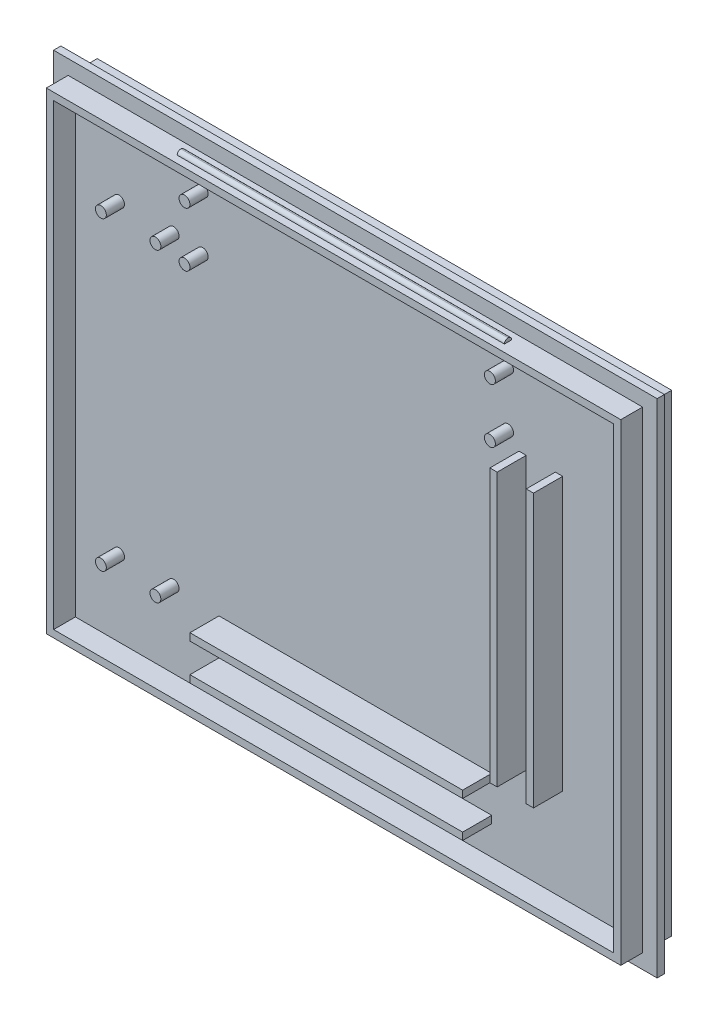
from build123d import *

# Parameters (mm, degrees)
SKETCH_1_W           = 166
SKETCH_1_H           = 138
EXTRUDE_1_DEPTH      = 2
EXTRUDE_2_DEPTH      = 6
EXTRUDE_2_DEPTH_BACK = 8
SKETCH_2_W           = 158
SKETCH_2_H           = 130
SKETCH_2_W_2         = 154
SKETCH_2_H_2         = 126
SKETCH_3_R           = 1.5
EXTRUDE_2_2_DEPTH    = 5
SKETCH_5_R           = 1.5
EXTRUDE_3_DEPTH      = 5
SKETCH_4_R           = 1.5
EXTRUDE_4_DEPTH      = 5
SKETCH_6_W           = 75
SKETCH_6_H           = 2
SKETCH_6_W_2         = 2
SKETCH_6_H_2         = 75
EXTRUDE_5_DEPTH      = 8
SKETCH_9_W           = 90
SKETCH_9_H           = 2
EXTRUDE_6_DEPTH      = 1
FILLET_1_R           = 1
SKETCH_11_W          = 90
SKETCH_11_H          = 2
EXTRUDE_7_DEPTH      = 1
FILLET_2_R           = 1


with BuildPart() as part:
    # 스케치1 → 보스-돌출1 (new body)
    with BuildSketch(Plane.XY):
        Rectangle(SKETCH_1_W, SKETCH_1_H)
    extrude(amount=EXTRUDE_1_DEPTH)

    # 스케치2 → Extrude 2 (add, two sides: drawn at the far end of the back side and taken through both)
    with BuildSketch(Plane.XY.offset(2).offset(-EXTRUDE_2_DEPTH_BACK)):
        Rectangle(SKETCH_2_W, SKETCH_2_H)
        Rectangle(SKETCH_2_W_2, SKETCH_2_H_2, mode=Mode.SUBTRACT)
    extrude(amount=EXTRUDE_2_DEPTH + EXTRUDE_2_DEPTH_BACK)

    # 스케치3 → Extrude 2 2 (add)
    with BuildSketch(Plane.XY.offset(2)):
        with Locations(Location((-65, -42, 0), (0, 0, 180))):
            Circle(SKETCH_3_R)
        with Locations(Location((-50, -42, 0), (0, 0, 180))):
            Circle(SKETCH_3_R)
        with Locations(Location((-65, 42, 0), (0, 0, 180))):
            Circle(SKETCH_3_R)
        with Locations(Location((-50, 42, 0), (0, 0, 180))):
            Circle(SKETCH_3_R)
    extrude(amount=EXTRUDE_2_2_DEPTH)

    # 스케치5 → 보스-돌출3 (add)
    with BuildSketch(Plane.XY.offset(2)):
        with Locations(Location((42, 56, 0), (0, 0, 180))):
            Circle(SKETCH_5_R)
        with Locations(Location((42, 41, 0), (0, 0, 180))):
            Circle(SKETCH_5_R)
    extrude(amount=EXTRUDE_3_DEPTH)

    # 스케치4 → 보스-돌출4 (add)
    with BuildSketch(Plane.XY.offset(2)):
        with Locations(Location((-42, 56, 0), (0, 0, 180))):
            Circle(SKETCH_4_R)
        with Locations(Location((-42, 41, 0), (0, 0, 180))):
            Circle(SKETCH_4_R)
    extrude(amount=EXTRUDE_4_DEPTH)

    # 스케치6 → 보스-돌출5 (add)
    with BuildSketch(Plane.XY.offset(2)):
        with Locations((0, -54)):
            Rectangle(SKETCH_6_W, SKETCH_6_H)
        with Locations((0, -44)):
            Rectangle(SKETCH_6_W, SKETCH_6_H)
        with Locations((46, 0)):
            Rectangle(SKETCH_6_W_2, SKETCH_6_H_2)
        with Locations((56, 0)):
            Rectangle(SKETCH_6_W_2, SKETCH_6_H_2)
    extrude(amount=EXTRUDE_5_DEPTH)

    # 스케치9 → 보스-돌출6 (add)
    with BuildSketch(Plane.XZ.offset(65)):
        with Locations((0, 5)):
            Rectangle(SKETCH_9_W, SKETCH_9_H)
    extrude(amount=EXTRUDE_6_DEPTH)

    # 필렛1
    fillet_1_edges = [part.edges().sort_by_distance(p)[0] for p in [
        (0, -66, 4),
        (0, -66, 6),
    ]]
    fillet(fillet_1_edges, radius=FILLET_1_R - 0.0001)  # a hair under: the kernel refuses the full size

    # 스케치11 → 보스-돌출7 (add)
    with BuildSketch(Plane(origin=(0, 65, 0), x_dir=(1, 0, 0), z_dir=(0, 1, 0))):
        with Locations((0, -5)):
            Rectangle(SKETCH_11_W, SKETCH_11_H)
    extrude(amount=EXTRUDE_7_DEPTH)

    # 필렛2
    fillet_2_edges = [part.edges().sort_by_distance(p)[0] for p in [
        (0, 66, 4),
        (0, 66, 6),
    ]]
    fillet(fillet_2_edges, radius=FILLET_2_R - 0.0001)  # a hair under: the kernel refuses the full size


solid = part.part
